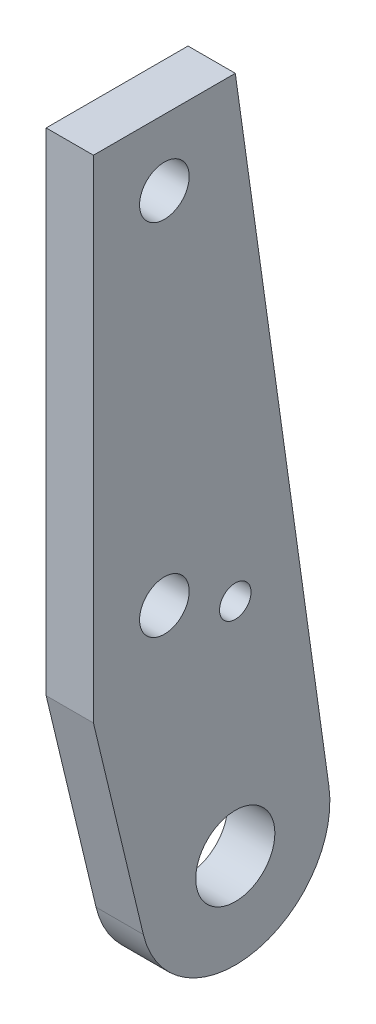
from build123d import *

# Parameters (mm, degrees)
BOSS_EXTRUDE1_START                        = -1.5
BOSS_EXTRUDE1_DEPTH                        = 3
PIVOTSHAFTHOLE_CUT_DEPTH                   = 26.816661287
PIVOTSHAFTHOLE_CUT_DEPTH_BACK              = 26.816661287
PIVOTSHAFTHOLE_SKETCH_R                    = 2.51
MOUNTHOLESTOENDBLOCKSEEDFODDER_START       = -1.5
MOUNTHOLESTOENDBLOCKSEEDFODDER_OUTLINE_R   = 2.51
MOUNTHOLESTOENDBLOCKSEEDFODDER_DEPTH       = 3
MOUNTHOLESTOENDBLOCKSEED_SKETCH_R          = 1.575
MOUNTHOLESTOENDBLOCKSEED_CUT_DEPTH         = 26.816661287
MOUNTHOLESTOENDBLOCKSEED_PATTERN_START     = -1.5
MOUNTHOLESTOENDBLOCKSEED_PATTERN_OUTLINE_R = 1.575
MOUNTHOLESTOENDBLOCKSEED_PATTERN_DEPTH     = 3
SPRINGANCHORHOLE_CUT_DEPTH                 = 26.816661287
SPRINGANCHORHOLE_CUT_DEPTH_BACK            = 26.816661287
SPRINGANCHORHOLE_SKETCH_R                  = 1


# Read off the part's stored shape, not the designer's step: mountHolesToEndBlockSeedFodder, mountHolesToEndBlockSeed_pattern
with BuildPart() as part:
    # Sketch1 → Boss-Extrude1 (new body)
    with BuildSketch(Plane(origin=(0, 0, 0), x_dir=(0, 0, -1), z_dir=(1, 0, 0)).offset(BOSS_EXTRUDE1_START)):
        with BuildLine():
            Line((2, 24.5), (7.941302937, -17.662790698))
            ThreePointArc((7.941302937, -17.662790698), (3.119056028, -24.394719129), (-3.834772709, -19.898365989))
            Line((-3.834772709, -19.898365989), (-7, -6.69125))
            Line((-7, -6.69125), (-7, 24.5))
            Line((-7, 24.5), (2, 24.5))
        make_face()
    extrude(amount=BOSS_EXTRUDE1_DEPTH)

    # pivotShaftHole_sketch → pivotShaftHole_cut (cut, two sides: drawn at the far end of the back side and taken through both)
    with BuildSketch(Plane(origin=(0, 0, 0), x_dir=(0, 0, -1), z_dir=(1, 0, 0)).offset(-PIVOTSHAFTHOLE_CUT_DEPTH_BACK)):
        with Locations((2, -18.5)):
            Circle(PIVOTSHAFTHOLE_SKETCH_R)
    extrude(amount=PIVOTSHAFTHOLE_CUT_DEPTH + PIVOTSHAFTHOLE_CUT_DEPTH_BACK, mode=Mode.SUBTRACT)

    # mountHolesToEndBlockSeed_pattern outline → mountHolesToEndBlockSeed_pattern (cut)
    with BuildSketch(Plane.YZ.offset(MOUNTHOLESTOENDBLOCKSEED_PATTERN_START)):
        with Locations((-2.49125, 2.5)):
            Circle(MOUNTHOLESTOENDBLOCKSEED_PATTERN_OUTLINE_R)
        with Locations((20.3, 2.5)):
            Circle(MOUNTHOLESTOENDBLOCKSEED_PATTERN_OUTLINE_R)
    extrude(amount=MOUNTHOLESTOENDBLOCKSEED_PATTERN_DEPTH, mode=Mode.SUBTRACT)

    # springAnchorHole_sketch → springAnchorHole_cut (cut, two sides: drawn at the far end of the back side and taken through both)
    with BuildSketch(Plane(origin=(0, 0, 0), x_dir=(0, 0, -1), z_dir=(1, 0, 0)).offset(-SPRINGANCHORHOLE_CUT_DEPTH_BACK)):
        with Locations((2, -4.5)):
            Circle(SPRINGANCHORHOLE_SKETCH_R)
    extrude(amount=SPRINGANCHORHOLE_CUT_DEPTH + SPRINGANCHORHOLE_CUT_DEPTH_BACK, mode=Mode.SUBTRACT)


with BuildPart() as body_2:
    # mountHolesToEndBlockSeedFodder outline → mountHolesToEndBlockSeedFodder (new body)
    with BuildSketch(Plane.YZ.offset(MOUNTHOLESTOENDBLOCKSEEDFODDER_START)):
        with BuildLine():
            Line((24.5, 7), (-6.69125, 7))
            Line((-6.69125, 7), (-19.898365989, 3.834772709))
            ThreePointArc((-19.898365989, 3.834772709), (-24.394719129, -3.119056028), (-17.662790698, -7.941302937))
            Line((-17.662790698, -7.941302937), (24.5, -2))
            Line((24.5, -2), (24.5, 7))
        make_face()
        with Locations((-18.5, -2)):
            Circle(MOUNTHOLESTOENDBLOCKSEEDFODDER_OUTLINE_R, mode=Mode.SUBTRACT)
    extrude(amount=MOUNTHOLESTOENDBLOCKSEEDFODDER_DEPTH)

    # mountHolesToEndBlockSeed_sketch → mountHolesToEndBlockSeed_cut (cut, symmetric)
    with BuildSketch(Plane(origin=(0, 0, 0), x_dir=(0, 0, -1), z_dir=(1, 0, 0))):
        Circle(MOUNTHOLESTOENDBLOCKSEED_SKETCH_R)
    extrude(amount=MOUNTHOLESTOENDBLOCKSEED_CUT_DEPTH, both=True, mode=Mode.SUBTRACT)


solid = part.part
